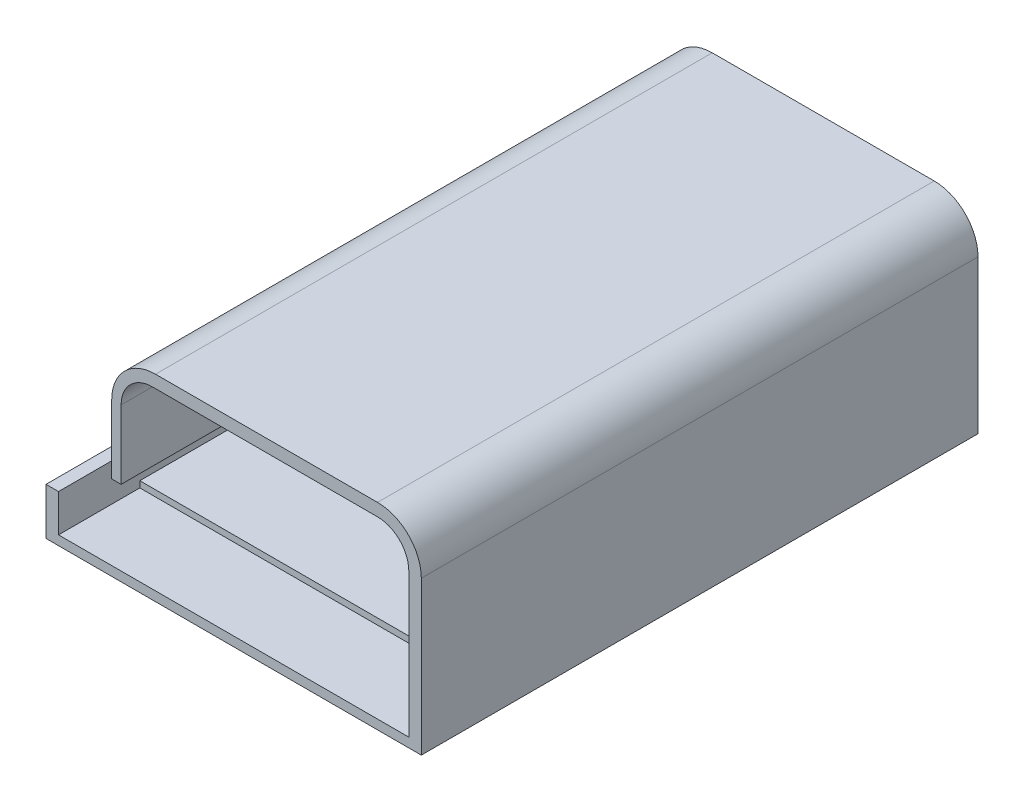
from build123d import *
from OCP.BRepFilletAPI import BRepFilletAPI_MakeFillet

# Parameters (mm, degrees)
BOSS_EXTRUDE1_DEPTH = 84
FILLET1_R1          = 7
FILLET1_R2          = 5
FILLET2_R1          = 5
FILLET2_R2          = 7
BOSS_EXTRUDE4_START = 2
BOSS_EXTRUDE4_DEPTH = 2
SKETCH8_W           = 56
SKETCH8_H           = 1
CUT_EXTRUDE1_DEPTH  = 10
BOSS_EXTRUDE7_DEPTH = 3
FILLET3_R           = 5
FILLET4_R           = 1
FILLET5_R           = 1


with BuildPart() as part:
    # Sketch5 → Boss-Extrude1 (new body)
    with BuildSketch(Plane.XY):
        Polygon((0, 0.52755518), (56, 0.52755518), (56, 27.52755518), (10.009451629, 27.52755518), (10.009451629, 11.52755518), (8.509451629, 11.52755518), (8.509451629, 29.52755518), (58, 29.52755518), (58, -1.97244482), (-2, -1.97244482), (-2, 5.52755518), (0, 5.52755518), align=None)
    extrude(amount=-BOSS_EXTRUDE1_DEPTH)

    # Fillet1: one fillet with a radius per group of edges: ONE call of the kernel's fillet builder (fillet() takes one radius for all edges)
    fillet1_edges_1 = [part.edges().sort_by_distance(p)[0] for p in [
        (8.509451629, 29.52755518, -42),
    ]]
    fillet1_edges_2 = [part.edges().sort_by_distance(p)[0] for p in [
        (10.009451629, 27.52755518, -42),
    ]]
    fillet1 = BRepFilletAPI_MakeFillet(part.part.solid().wrapped)
    for e in fillet1_edges_1:
        fillet1.Add(FILLET1_R1, e.wrapped)
    for e in fillet1_edges_2:
        fillet1.Add(FILLET1_R2, e.wrapped)
    add(Compound.cast(fillet1.Shape()), mode=Mode.REPLACE)

    # Fillet2: one fillet with a radius per group of edges: ONE call of the kernel's fillet builder (fillet() takes one radius for all edges)
    fillet2_edges_1 = [part.edges().sort_by_distance(p)[0] for p in [
        (56, 27.52755518, -42),
    ]]
    fillet2_edges_2 = [part.edges().sort_by_distance(p)[0] for p in [
        (58, 29.52755518, -42),
    ]]
    fillet2 = BRepFilletAPI_MakeFillet(part.part.solid().wrapped)
    for e in fillet2_edges_1:
        fillet2.Add(FILLET2_R1, e.wrapped)
    for e in fillet2_edges_2:
        fillet2.Add(FILLET2_R2, e.wrapped)
    add(Compound.cast(fillet2.Shape()), mode=Mode.REPLACE)

    # Sketch6 → Boss-Extrude4 (add)
    with BuildSketch(Plane(origin=(0, 0, -84), x_dir=(-1, 0, 0), z_dir=(0, 0, -1)).offset(BOSS_EXTRUDE4_START)):
        with BuildLine():
            Line((0, 5.52755518), (2, 5.52755518))
            Line((2, 5.52755518), (2, -1.97244482))
            Line((2, -1.97244482), (-58, -1.97244482))
            Line((-58, -1.97244482), (-58, 22.52755518))
            ThreePointArc((-58, 22.52755518), (-55.949747468, 27.477302648), (-51, 29.52755518))
            Line((-51, 29.52755518), (-15.509451629, 29.52755518))
            ThreePointArc((-15.509451629, 29.52755518), (-10.559704161, 27.477302648), (-8.509451629, 22.52755518))
            Line((-8.509451629, 22.52755518), (-8.509451629, 11.52755518))
            Line((-8.509451629, 11.52755518), (-8.509451629, 5.52755518))
            Line((-8.509451629, 5.52755518), (0, 5.52755518))
        make_face()
    extrude(amount=-BOSS_EXTRUDE4_DEPTH)

    # Sketch8 → Cut-Extrude1 (cut)
    with BuildSketch(Plane.XY):
        with Locations((28, 0.02755518)):
            Rectangle(SKETCH8_W, SKETCH8_H)
    extrude(amount=-CUT_EXTRUDE1_DEPTH, mode=Mode.SUBTRACT)

    # Sketch11 → Boss-Extrude7 (add)
    with BuildSketch(Plane.XY):
        with BuildLine():
            Line((56, 22.52755518), (56, -0.47244482))
            Line((56, -0.47244482), (0, -0.47244482))
            Line((0, -0.47244482), (0, 5.52755518))
            Line((0, 5.52755518), (-2, 5.52755518))
            Line((-2, 5.52755518), (-2, -1.97244482))
            Line((-2, -1.97244482), (58, -1.97244482))
            Line((58, -1.97244482), (58, 22.52755518))
            ThreePointArc((58, 22.52755518), (55.949747468, 27.477302648), (51, 29.52755518))
            Line((51, 29.52755518), (15.509451629, 29.52755518))
            ThreePointArc((15.509451629, 29.52755518), (10.559704161, 27.477302648), (8.509451629, 22.52755518))
            Line((8.509451629, 22.52755518), (8.509451629, 11.52755518))
            Line((8.509451629, 11.52755518), (10.009451629, 11.52755518))
            Line((10.009451629, 11.52755518), (10.009451629, 22.52755518))
            ThreePointArc((10.009451629, 22.52755518), (11.473917723, 26.063089086), (15.009451629, 27.52755518))
            Line((15.009451629, 27.52755518), (51, 27.52755518))
            ThreePointArc((51, 27.52755518), (54.535533906, 26.063089086), (56, 22.52755518))
        make_face()
    extrude(amount=BOSS_EXTRUDE7_DEPTH)

    # Fillet3
    fillet3_edges = [part.edges().sort_by_distance(p)[0] for p in [
        (8.509451629, 5.52755518, -85),
    ]]
    fillet(fillet3_edges, radius=FILLET3_R)

    # Fillet4
    fillet4_edges = [part.edges().sort_by_distance(p)[0] for p in [
        (10.009451629, 17.02755518, -84),
        (11.473917723, 26.063089086, -84),
        (56, 11.52755518, -84),
        (54.535533906, 26.063089086, -84),
        (28, 0.52755518, -84),
        (33.004725815, 27.52755518, -84),
    ]]
    fillet(fillet4_edges, radius=FILLET4_R)

    # Fillet5
    fillet5_edges = [part.edges().sort_by_distance(p)[0] for p in [
        (9.759451629, 11.52755518, -84),
    ]]
    fillet(fillet5_edges, radius=FILLET5_R)


solid = part.part
